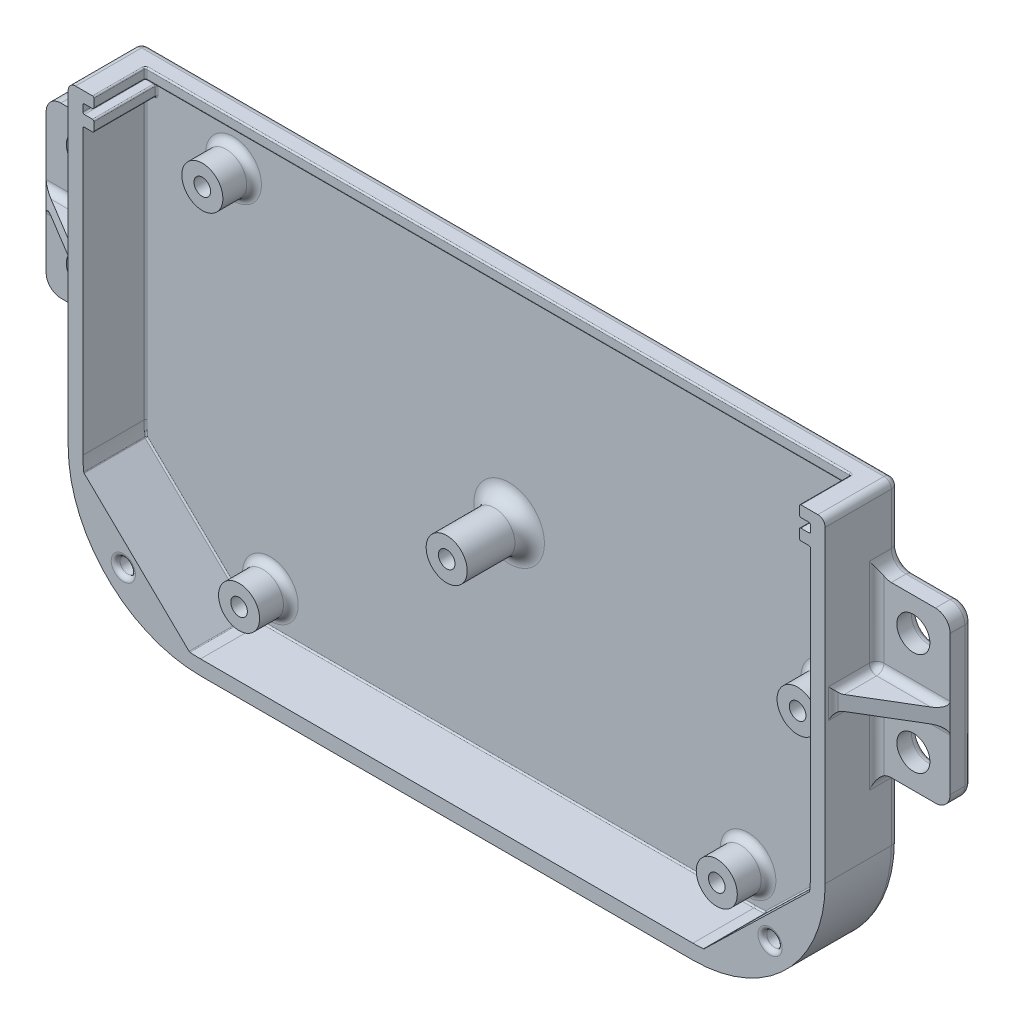
from build123d import *

# Parameters (mm, degrees)
BOSS_EXTRU_1_DEPTH      = 10
ENL_V_MAT_EXTRU_1_DEPTH = 8.5
ESQUISSE3_W             = 99
ESQUISSE3_H             = 1.5
BOSS_EXTRU_2_DEPTH      = 1.5
ESQUISSE4_W             = 1.5
ESQUISSE4_H             = 1.5
BOSS_EXTRU_3_DEPTH      = 8.5
ESQUISSE6_W             = 10
ESQUISSE6_H             = 23
ESQUISSE6_R             = 2.25
BOSS_EXTRU_5_DEPTH      = 3
CONG_3_R                = 2
CONG_4_R                = 1
CONG_5_R                = 1
BOSS_EXTRU_6_START      = 8.5
BOSS_EXTRU_6_DEPTH      = 8.5
ESQUISSE8_R             = 1.05
ENL_V_MAT_EXTRU_2_DEPTH = 5
ESQUISSE9_R             = 2.794
BOSS_EXTRU_7_DEPTH      = 8.5
CONG_7_R                = 2
ESQUISSE10_R            = 0.5
ENL_V_MAT_EXTRU_3_DEPTH = 1
ESQUISSE11_R            = 2.794
BOSS_EXTRU_8_DEPTH      = 4.25
ESQUISSE12_R            = 1.1303
ENL_V_MAT_EXTRU_4_DEPTH = 4.25
CONG_8_R                = 1
CONG_9_R                = 0.6
BOSS_EXTRU_9_START      = -12
BOSS_EXTRU_9_DEPTH      = 2
CONG_10_R               = 1
CONG_11_R               = 0.2
SKETCH1_R               = 1.1303
CUT_EXTRUDE1_DEPTH      = 8.5


with BuildPart() as part:
    # Esquisse1 → Boss.-Extru.1 (new body)
    with BuildSketch(Plane.XY):
        with BuildLine():
            Line((-51.5, 2), (51.5, 2))
            Line((51.5, 2), (51.5, -41))
            ThreePointArc((51.5, -41), (46.227922061, -53.727922061), (33.5, -59))
            Line((33.5, -59), (-33.5, -59))
            ThreePointArc((-33.5, -59), (-46.227922061, -53.727922061), (-51.5, -41))
            Line((-51.5, -41), (-51.5, 2))
        make_face()
    extrude(amount=BOSS_EXTRU_1_DEPTH)

    # Esquisse2 → Enlèv. mat.-Extru.1 (cut)
    with BuildSketch(Plane.XY.offset(10)):
        with BuildLine():
            Line((-49.5, 2), (49.5, 2))
            Line((49.5, 2), (49.5, -41))
            ThreePointArc((49.5, -41), (44.813708499, -52.313708499), (33.5, -57))
            Line((33.5, -57), (-33.5, -57))
            ThreePointArc((-33.5, -57), (-44.813708499, -52.313708499), (-49.5, -41))
            Line((-49.5, -41), (-49.5, 2))
        make_face()
    extrude(amount=-ENL_V_MAT_EXTRU_1_DEPTH, mode=Mode.SUBTRACT)

    # Esquisse3 → Boss.-Extru.2 (add)
    with BuildSketch(Plane.XY.offset(1.5)):
        with Locations((0, 1.25)):
            Rectangle(ESQUISSE3_W, ESQUISSE3_H)
    extrude(amount=BOSS_EXTRU_2_DEPTH)

    # Esquisse4 → Boss.-Extru.3 (add)
    with BuildSketch(Plane.XY.offset(1.5)):
        with Locations((-48.75, -1.5)):
            Rectangle(ESQUISSE4_W, ESQUISSE4_H)
        with Locations((48.75, -1.5)):
            Rectangle(ESQUISSE4_W, ESQUISSE4_H)
        with Locations((48.75, 1.25)):
            Rectangle(ESQUISSE4_W, ESQUISSE4_H)
        with Locations((-48.75, 1.25)):
            Rectangle(ESQUISSE4_W, ESQUISSE4_H)
    extrude(amount=BOSS_EXTRU_3_DEPTH)

    # Esquisse6 → Boss.-Extru.5 (add)
    # profile 1 of 2: a face of its own
    with BuildSketch(Plane(origin=(0, 0, 0), x_dir=(-1, 0, 0), z_dir=(0, 0, -1))):
        with Locations((-56.5, -19.5)):
            Rectangle(ESQUISSE6_W, ESQUISSE6_H)
        with Locations((-56.5, -12.5)):
            Circle(ESQUISSE6_R, mode=Mode.SUBTRACT)
        with Locations((-56.5, -26.5)):
            Circle(ESQUISSE6_R, mode=Mode.SUBTRACT)
    # profile 2 of 2: a face of its own
    with BuildSketch(Plane(origin=(0, 0, 0), x_dir=(-1, 0, 0), z_dir=(0, 0, -1))):
        with Locations((56.5, -19.5)):
            Rectangle(ESQUISSE6_W, ESQUISSE6_H)
        with Locations(Location((56.5, -12.5, 0), (0, 0, 180))):
            Circle(ESQUISSE6_R, mode=Mode.SUBTRACT)
        with Locations(Location((56.5, -26.5, 0), (0, 0, 180))):
            Circle(ESQUISSE6_R, mode=Mode.SUBTRACT)
    extrude(amount=-BOSS_EXTRU_5_DEPTH)

    # Congé3
    cong_3_edges = [part.edges().sort_by_distance(p)[0] for p in [
        (51.5, -8, 1.5),
        (51.5, -31, 1.5),
        (61.5, -31, 1.5),
        (61.5, -8, 1.5),
        (-51.5, -8, 1.5),
        (-61.5, -8, 1.5),
        (-61.5, -31, 1.5),
        (-51.5, -31, 1.5),
    ]]
    fillet(cong_3_edges, radius=CONG_3_R)

    # Congé4
    cong_4_edges = [part.edges().sort_by_distance(p)[0] for p in [
        (58.75, -12.5, 0),
        (58.75, -26.5, 0),
        (-58.75, -12.5, 0),
        (-58.75, -26.5, 0),
        (51.5, -2, 0),
        (56.5, -8, 0),
        (61.5, -19.5, 0),
        (56.5, -31, 0),
        (-51.5, -37, 0),
        (-56.5, -31, 0),
        (-61.5, -19.5, 0),
        (-56.5, -8, 0),
        (-60.914213562, -30.414213562, 0),
        (-60.914213562, -8.585786438, 0),
        (60.914213562, -30.414213562, 0),
        (60.914213562, -8.585786438, 0),
        (52.085786438, -7.414213562, 0),
        (52.085786438, -31.585786438, 0),
        (-52.085786438, -7.414213562, 0),
        (-52.085786438, -31.585786438, 0),
        (0, 2, 0),
        (51.5, -37, 0),
        (46.227922061, -53.727922061, 0),
        (0, -59, 0),
        (-46.227922061, -53.727922061, 0),
        (-51.5, -2, 0),
    ]]
    fillet(cong_4_edges, radius=CONG_4_R)

    # Congé5
    cong_5_edges = [part.edges().sort_by_distance(p)[0] for p in [
        (51.5, -19.5, 3),
        (-51.5, -19.5, 3),
    ]]
    fillet(cong_5_edges, radius=CONG_5_R)
    # the kernel refuses this fillet: 1 mm, written as the material it takes off along each edge
    with BuildSketch(Plane(origin=(-50.5, 1, 1), x_dir=(-1, 0, 0), z_dir=(0, 1, 0))) as cong_5_2_piece_1_section:
        Polygon((0, 0), (CONG_5_R * 1.02, 0), (CONG_5_R * 1.02, -CONG_5_R * 1.02), (0, -CONG_5_R * 1.02), align=None)
    cong_5_2_piece_1 = extrude(amount=CONG_5_R * 1.02, mode=Mode.PRIVATE)
    cong_5_2_piece_1 = cong_5_2_piece_1 - Plane(origin=(-50.5, 1, 1), x_dir=(0.7071067811865475, 0, 0.7071067811865475), z_dir=(0, 1, 0)) * Sphere(CONG_5_R, mode=Mode.PRIVATE)
    add(cong_5_2_piece_1, mode=Mode.SUBTRACT)
    with BuildSketch(Plane(origin=(50.5, 1, 1), x_dir=(0, 1, 0), z_dir=(1, 0, 0))) as cong_5_2_piece_2_section:
        Polygon((0, 0), (CONG_5_R * 1.02, 0), (CONG_5_R * 1.02, -CONG_5_R * 1.02), (0, -CONG_5_R * 1.02), align=None)
    cong_5_2_piece_2 = extrude(amount=CONG_5_R * 1.02, mode=Mode.PRIVATE)
    cong_5_2_piece_2 = cong_5_2_piece_2 - Plane(origin=(50.5, 1, 1), x_dir=(0, -0.7071067811865475, 0.7071067811865475), z_dir=(1, 0, 0)) * Sphere(CONG_5_R, mode=Mode.PRIVATE)
    add(cong_5_2_piece_2, mode=Mode.SUBTRACT)
    with BuildSketch(Plane(origin=(-51.5, 2, 1), x_dir=(1, 0, 0), z_dir=(0, 0, 1)), Plane(origin=(51.5, 2, 1), x_dir=(0, -1, 0), z_dir=(0, 0, 1))) as cong_5_2_piece_3:
        with BuildLine():
            CenterArc((CONG_5_R, -CONG_5_R), CONG_5_R, 90, 90)
            Line((0, -CONG_5_R), (-CONG_5_R * 0.02, -CONG_5_R))
            Line((-CONG_5_R * 0.02, -CONG_5_R), (-CONG_5_R * 0.02, CONG_5_R * 0.02))
            Line((-CONG_5_R * 0.02, CONG_5_R * 0.02), (CONG_5_R, CONG_5_R * 0.02))
            Line((CONG_5_R, CONG_5_R * 0.02), (CONG_5_R, 0))
        make_face()
    extrude(amount=11.5, mode=Mode.SUBTRACT)

    # Esquisse7 → Boss.-Extru.6 (add)
    with BuildSketch(Plane.XY.offset(1.5).offset(BOSS_EXTRU_6_START)):
        with BuildLine():
            Line((-49.374507866, -43), (-35, -56.929532322))
            ThreePointArc((-35, -56.929532322), (-44.634466695, -52.490154543), (-49.374507866, -43))
        make_face()
        with BuildLine():
            Line((49.374507866, -43), (35, -56.929532322))
            ThreePointArc((35, -56.929532322), (44.634466695, -52.490154543), (49.374507866, -43))
        make_face()
    extrude(amount=-BOSS_EXTRU_6_DEPTH)

    # Esquisse8 → Enlèv. mat.-Extru.2 (cut)
    with BuildSketch(Plane.XY.offset(10)):
        with Locations((-44, -51.5)):
            Circle(ESQUISSE8_R)
        with Locations(Location((44, -51.5, 0), (0, 0, 180))):
            Circle(ESQUISSE8_R)
    extrude(amount=-ENL_V_MAT_EXTRU_2_DEPTH, mode=Mode.SUBTRACT)

    # Esquisse9 → Boss.-Extru.7 (add)
    with BuildSketch(Plane.XY.offset(1.5)):
        with Locations(Location((0, -28.5, 0), (0, 0, 180))):
            Circle(ESQUISSE9_R)
    extrude(amount=BOSS_EXTRU_7_DEPTH)

    # Congé7
    cong_7_edges = [part.edges().sort_by_distance(p)[0] for p in [
        (2.794, -28.5, 1.5),
    ]]
    fillet(cong_7_edges, radius=CONG_7_R)

    # Esquisse10 → Enlèv. mat.-Extru.3 (cut)
    with BuildSketch(Plane.XY.offset(10)):
        with Locations((0, -28.5)):
            Circle(ESQUISSE10_R)
    extrude(amount=-ENL_V_MAT_EXTRU_3_DEPTH, mode=Mode.SUBTRACT)

    # Esquisse11 → Boss.-Extru.8 (add)
    with BuildSketch(Plane.XY.offset(1.5)):
        with Locations(Location((-37.5, -5.5, 0), (0, 0, 180))):
            Circle(ESQUISSE11_R)
        with Locations(Location((43.5, -26.75, 0), (0, 0, 180))):
            Circle(ESQUISSE11_R)
        with Locations(Location((-32.5, -52.5, 0), (0, 0, 180))):
            Circle(ESQUISSE11_R)
        with Locations(Location((32.5, -52.5, 0), (0, 0, 180))):
            Circle(ESQUISSE11_R)
    extrude(amount=BOSS_EXTRU_8_DEPTH)

    # Esquisse12 → Enlèv. mat.-Extru.4 (cut)
    with BuildSketch(Plane.XY.offset(5.75)):
        with Locations((-37.5, -5.5)):
            Circle(ESQUISSE12_R)
        with Locations((-32.5, -52.5)):
            Circle(ESQUISSE12_R)
        with Locations((32.5, -52.5)):
            Circle(ESQUISSE12_R)
        with Locations((43.5, -26.75)):
            Circle(ESQUISSE12_R)
    extrude(amount=-ENL_V_MAT_EXTRU_4_DEPTH, mode=Mode.SUBTRACT)

    # Congé8
    cong_8_edges = [part.edges().sort_by_distance(p)[0] for p in [
        (-34.706, -5.5, 1.5),
        (46.294, -26.75, 1.5),
        (-29.706, -52.5, 1.5),
        (35.294, -52.5, 1.5),
    ]]
    fillet(cong_8_edges, radius=CONG_8_R)

    # Congé9
    cong_9_edges = [part.edges().sort_by_distance(p)[0] for p in [
        (-45.05, -51.5, 10),
        (45.05, -51.5, 10),
    ]]
    fillet(cong_9_edges, radius=CONG_9_R)

    # Esquisse14 → Boss.-Extru.9 (add)
    with BuildSketch(Plane.XZ.offset(31).offset(BOSS_EXTRU_9_START)):
        Polygon((-61.5, 3), (-51.5, 9), (-51.5, 3), align=None)
        Polygon((51.5, 9), (51.5, 3), (61.5, 3), align=None)
    extrude(amount=BOSS_EXTRU_9_DEPTH)

    # Congé10
    cong_10_edges = [part.edges().sort_by_distance(p)[0] for p in [
        (-51.792893219, -19, 3.292893219),
        (-51.792893219, -21, 3.292893219),
        (-51.5, -19, 6.5),
        (-51.5, -21, 6.5),
        (-57, -21, 3),
        (-57, -19, 3),
        (-51.5, -20, 9),
        (51.792893219, -19, 3.292893219),
        (51.792893219, -21, 3.292893219),
        (51.5, -19, 6.5),
        (51.5, -20, 9),
        (57, -21, 3),
        (51.5, -21, 6.5),
        (57, -19, 3),
    ]]
    fillet(cong_10_edges, radius=CONG_10_R)

    # Congé11
    cong_11_edges = [part.edges().sort_by_distance(p)[0] for p in [
        (48, -1.5, 1.5),
        (-48, -1.5, 1.5),
        (49.468596148, -42.001966601, 1.5),
        (-34.250827159, -56.982373371, 1.5),
        (34.250827159, -56.982373371, 1.5),
        (-49.468596148, -42.001966601, 1.5),
        (35, -56.929532322, 5.75),
        (49.374507866, -43, 5.75),
        (-49.374507866, -43, 5.75),
        (-35, -56.929532322, 5.75),
        (48.75, -2.25, 1.5),
        (48, -2.25, 5.75),
        (49.5, -2.25, 5.75),
        (49.5, -21.625, 1.5),
        (42.187253933, -49.964766161, 1.5),
        (0, -57, 1.5),
        (-42.187253933, -49.964766161, 1.5),
        (-48, -2.25, 5.75),
        (-49.5, -2.25, 5.75),
        (-49.5, -21.625, 1.5),
        (-48.75, -2.25, 1.5),
        (48.75, -0.75, 1.5),
        (0, 2, 3),
        (0, 0.5, 3),
        (48, 1.25, 3),
        (48, 2, 6.5),
        (48, 0.5, 6.5),
        (49.5, 0.5, 5.75),
        (49.5, -0.75, 5.75),
        (48, -0.75, 5.75),
        (-48, 2, 6.5),
        (-48, 1.25, 3),
        (-48, 0.5, 6.5),
        (0, 0.5, 1.5),
        (-49.5, 0.5, 5.75),
        (-49.5, -0.75, 5.75),
        (-48, -0.75, 5.75),
        (-48.75, -0.75, 1.5),
    ]]
    fillet(cong_11_edges, radius=CONG_11_R)

    # Sketch1 → Cut-Extrude1 (cut)
    with BuildSketch(Plane.XY.offset(10)):
        with Locations((0, -28.5)):
            Circle(SKETCH1_R)
    extrude(amount=-CUT_EXTRUDE1_DEPTH, mode=Mode.SUBTRACT)


solid = part.part
